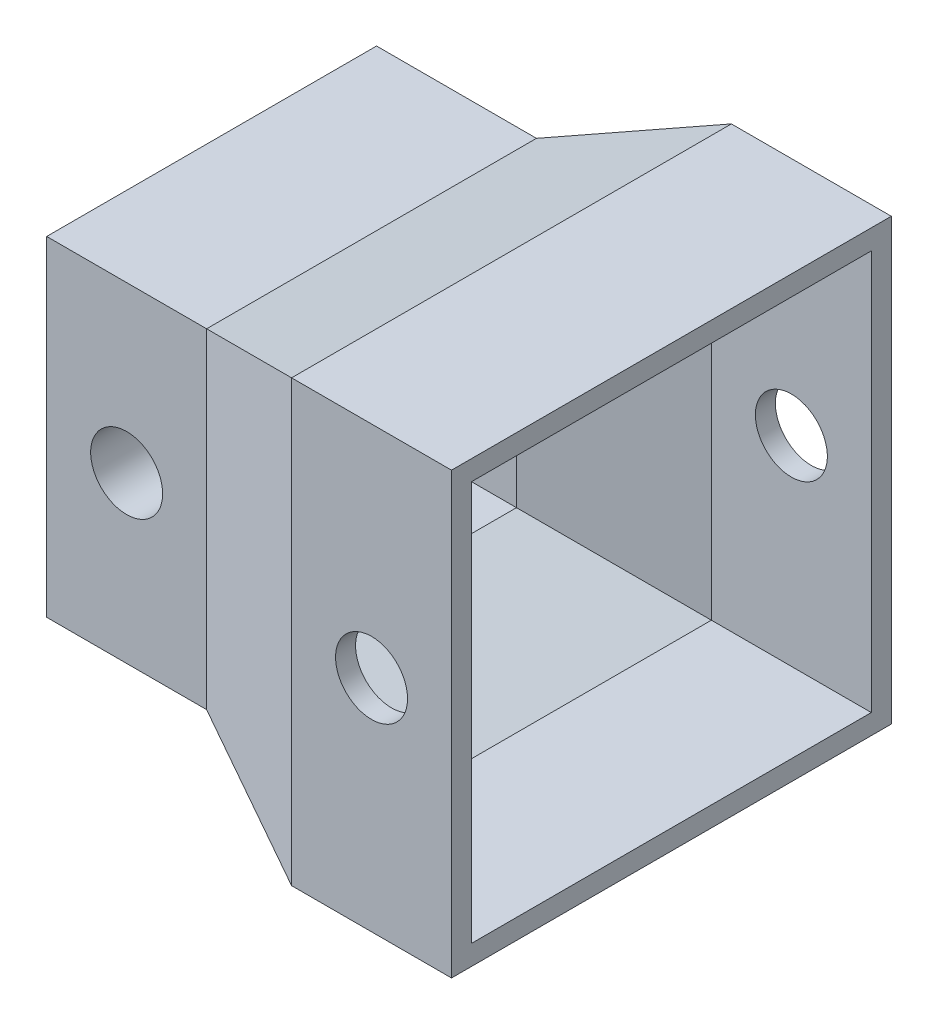
from build123d import *

# Parameters (mm, degrees)
SKETCH_1_R               = 2.5
EXTRUDE_1_DEPTH          = 1.5
SKETCH_2_R               = 3.5
EXTRUDE_2_DEPTH          = 1
SKETCH_3_R               = 2.5
EXTRUDE_3_DEPTH          = 2.5
SKETCH_4_R               = 3.5
EXTRUDE_4_DEPTH          = 1
SKETCH_5_R               = 2.5
EXTRUDE_5_DEPTH          = 2.5
SKETCH_6_R               = 3.5
EXTRUDE_6_DEPTH          = 1
SKETCH_7_R               = 2.5
EXTRUDE_7_DEPTH          = 2.5
SKETCH_10_R              = 3.5
EXTRUDE_9_DEPTH          = 1
SKETCH_11_R              = 2.5
EXTRUDE_10_DEPTH         = 1.5
SKETCH_12_R              = 1.8
CUT_EXTRUDE_2_DEPTH      = 16.321553446
EXTRUDE_11_DEPTH         = 4
EXTRUDE_11_DEPTH_BACK    = 4
SKETCH_13_W              = 22
SKETCH_13_H              = 22
SKETCH_13_W_2            = 20
SKETCH_13_H_2            = 20
EXTRUDE_12_DEPTH         = 4
EXTRUDE_12_DEPTH_BACK    = 4
SKETCH_14_W              = 16.5
SKETCH_14_H              = 16.5
SKETCH_14_W_2            = 14.5
SKETCH_14_H_2            = 14.5
PATTERN_CIRCULAR_1_COUNT = 4
SKETCH_19_R              = 1.8
CUT_EXTRUDE_3_DEPTH      = 30.198673019
SKETCH_20_R              = 1.8
CUT_EXTRUDE_4_DEPTH      = 32.080540642


with BuildPart() as part:
    # ｽｹｯﾁ1 → ﾎﾞｽ - 押し出し1 (new body)
    with BuildSketch(Plane.XY):
        Circle(SKETCH_1_R)
    extrude(amount=EXTRUDE_1_DEPTH)

    # ｽｹｯﾁ2 → ﾎﾞｽ - 押し出し2 (add)
    with BuildSketch(Plane.XY.offset(1.5)):
        Circle(SKETCH_2_R)
    extrude(amount=EXTRUDE_2_DEPTH)

    # ｽｹｯﾁ3 → ﾎﾞｽ - 押し出し3 (add)
    with BuildSketch(Plane.XY.offset(2.5)):
        Circle(SKETCH_3_R)
    extrude(amount=EXTRUDE_3_DEPTH)

    # ｽｹｯﾁ4 → ﾎﾞｽ - 押し出し4 (add)
    with BuildSketch(Plane.XY.offset(5)):
        Circle(SKETCH_4_R)
    extrude(amount=EXTRUDE_4_DEPTH)

    # ｽｹｯﾁ5 → ﾎﾞｽ - 押し出し5 (add)
    with BuildSketch(Plane.XY.offset(6)):
        Circle(SKETCH_5_R)
    extrude(amount=EXTRUDE_5_DEPTH)

    # ｽｹｯﾁ6 → ﾎﾞｽ - 押し出し6 (add)
    with BuildSketch(Plane.XY.offset(8.5)):
        Circle(SKETCH_6_R)
    extrude(amount=EXTRUDE_6_DEPTH)

    # ｽｹｯﾁ7 → ﾎﾞｽ - 押し出し7 (add)
    with BuildSketch(Plane.XY.offset(9.5)):
        Circle(SKETCH_7_R)
    extrude(amount=EXTRUDE_7_DEPTH)

    # ｽｹｯﾁ10 → ﾎﾞｽ - 押し出し9 (add)
    with BuildSketch(Plane.XY.offset(12)):
        Circle(SKETCH_10_R)
    extrude(amount=EXTRUDE_9_DEPTH)

    # ｽｹｯﾁ11 → ﾎﾞｽ - 押し出し10 (add)
    with BuildSketch(Plane.XY.offset(13)):
        Circle(SKETCH_11_R)
    extrude(amount=EXTRUDE_10_DEPTH)

    # ｽｹｯﾁ12 → ｶｯﾄ - 押し出し2 (cut, through all)
    with BuildSketch(Plane.XY.offset(14.5)):
        Circle(SKETCH_12_R)
    extrude(amount=-CUT_EXTRUDE_2_DEPTH, mode=Mode.SUBTRACT)

    # ｽｹｯﾁ14 → ﾎﾞｽ - 押し出し12 (add, two sides: drawn at the far end of the back side and taken through both)
    with BuildSketch(Plane(origin=(0, 0, 0), x_dir=(0, 0, -1), z_dir=(1, 0, 0)).offset(-EXTRUDE_12_DEPTH_BACK)):
        with Locations((-7.25, 0)):
            Rectangle(SKETCH_14_W, SKETCH_14_H)
        with Locations((-7.25, 0)):
            Rectangle(SKETCH_14_W_2, SKETCH_14_H_2, mode=Mode.SUBTRACT)
    extrude(amount=EXTRUDE_12_DEPTH + EXTRUDE_12_DEPTH_BACK)



with BuildPart() as body_2:
    # ｽｹｯﾁ13 → ﾎﾞｽ - 押し出し11 (new, two sides: drawn at the far end of the back side and taken through both)
    with BuildSketch(Plane(origin=(15, 0, 0), x_dir=(0, 0, -1), z_dir=(1, 0, 0)).offset(-EXTRUDE_11_DEPTH_BACK)):
        with Locations((-7.25, 0)):
            Rectangle(SKETCH_13_W, SKETCH_13_H)
        with Locations((-7.25, 0)):
            Rectangle(SKETCH_13_W_2, SKETCH_13_H_2, mode=Mode.SUBTRACT)
    extrude(amount=EXTRUDE_11_DEPTH + EXTRUDE_11_DEPTH_BACK)


with BuildPart() as part_1:
    add(part.part)

    add(body_2.part)  # ﾛﾌﾄ2 merges body 2
    # ｽｹｯﾁ16 → ﾛﾌﾄ2 section 0
    with BuildSketch(Plane.ZY.offset(-11)):
        with BuildLine():
            Line((-3.75, 11), (-2.75, 10))
            Line((-2.75, 10), (17.25, 10))
            Line((17.25, 10), (18.25, 11))
            Line((18.25, 11), (-3.75, 11))
        make_face()
    # ｽｹｯﾁ17 → ﾛﾌﾄ2 section 1
    with BuildSketch(Plane(origin=(4, 0, 0), x_dir=(0, 0, -1), z_dir=(1, 0, 0))):
        with BuildLine():
            Line((-15.5, 8.25), (-14.5, 7.25))
            Line((-14.5, 7.25), (0, 7.25))
            Line((0, 7.25), (1, 8.25))
            Line((1, 8.25), (-15.5, 8.25))
        make_face()
    loft_2 = loft()

    # 円形ﾊﾟﾀｰﾝ1: ﾛﾌﾄ2 ×4 about axis
    pattern_circular_1_axis = Axis((0, 0, 7.25), (-1, 0, 0))
    for i in range(1, PATTERN_CIRCULAR_1_COUNT):
        add(loft_2.rotate(pattern_circular_1_axis, i * 360 / PATTERN_CIRCULAR_1_COUNT))

    # ｽｹｯﾁ19 → ｶｯﾄ - 押し出し3 (cut, through all)
    with BuildSketch(Plane.XY.offset(15.5)):
        Circle(SKETCH_19_R)
    extrude(amount=-CUT_EXTRUDE_3_DEPTH, mode=Mode.SUBTRACT)

    # ｽｹｯﾁ20 → ｶｯﾄ - 押し出し4 (cut, through all)
    with BuildSketch(Plane.XY.offset(18.25)):
        with Locations((15, 0)):
            Circle(SKETCH_20_R)
    extrude(amount=-CUT_EXTRUDE_4_DEPTH, mode=Mode.SUBTRACT)


solid = part_1.part
